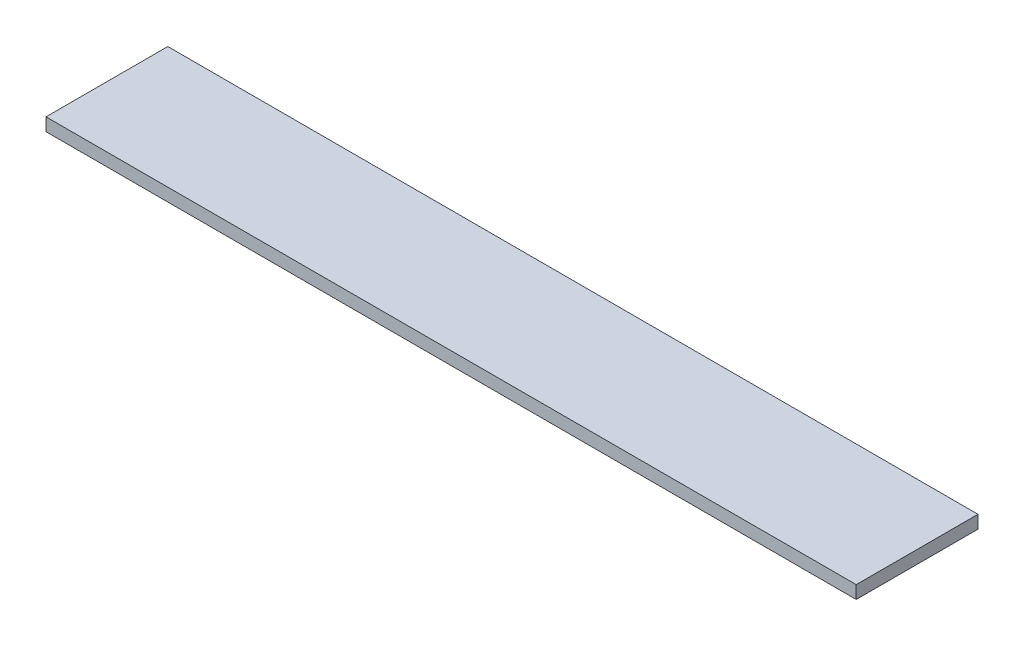
from build123d import *

# Parameters (mm, degrees)
SKETCH1_W           = 199.58
SKETCH1_H           = 30
BOSS_EXTRUDE1_DEPTH = 3.175


with BuildPart() as part:
    # Sketch1 → Boss-Extrude1 (new body)
    with BuildSketch(Plane(origin=(0, 0, 0), x_dir=(1, 0, 0), z_dir=(0, 1, 0))):
        with Locations((99.79, 15)):
            Rectangle(SKETCH1_W, SKETCH1_H)
    extrude(amount=BOSS_EXTRUDE1_DEPTH)


solid = part.part
